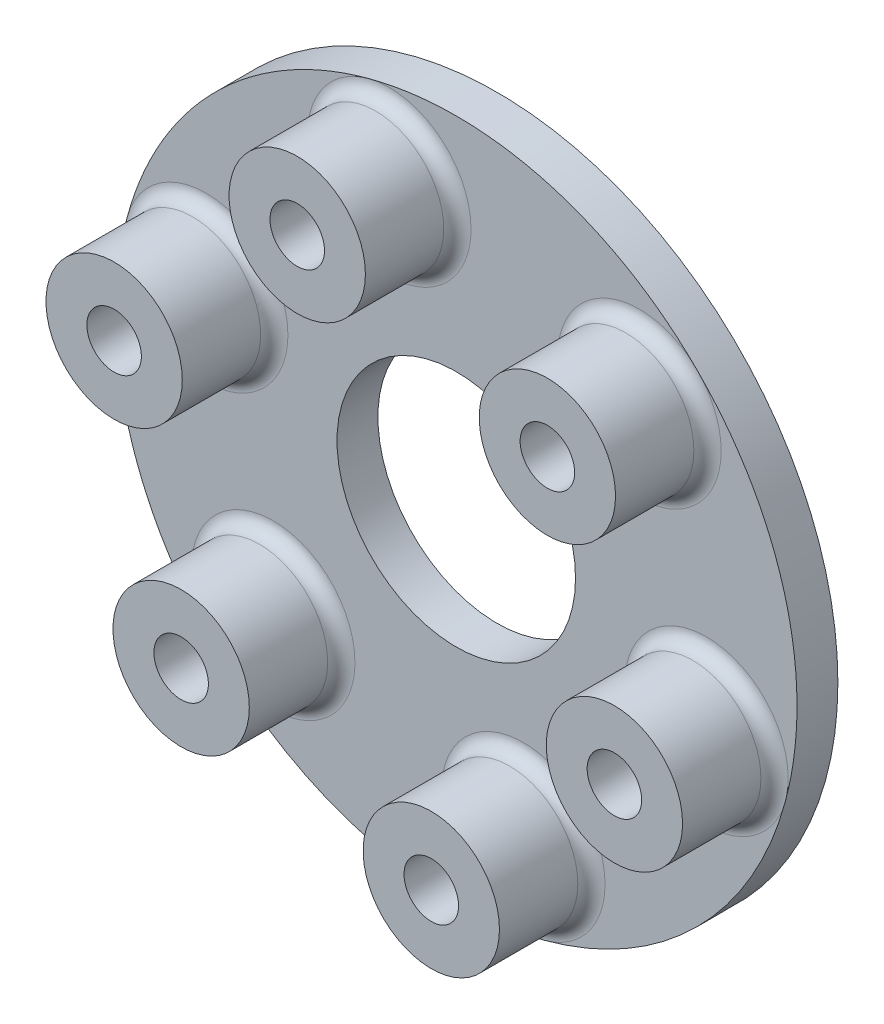
from build123d import *

# Parameters (mm, degrees)
SKETCH1_R           = 25
SKETCH1_R_2         = 8.75
BOSS_EXTRUDE1_DEPTH = 3
SKETCH2_R           = 5
SKETCH2_R_2         = 2
BOSS_EXTRUDE2_DEPTH = 6.75
CUT_EXTRUDE1_START  = -6.75
SKETCH5_R           = 2
CUT_EXTRUDE1_DEPTH  = 6.75
FILLET4_R           = 1
FILLET5_R           = 1
FILLET6_R           = 1
FILLET7_R           = 1
FILLET8_R           = 1
FILLET9_R           = 1


with BuildPart() as part:
    # Sketch1 → Boss-Extrude1 (new body)
    with BuildSketch(Plane.XY):
        Circle(SKETCH1_R)
        Circle(SKETCH1_R_2, mode=Mode.SUBTRACT)
    extrude(amount=BOSS_EXTRUDE1_DEPTH)

    # Sketch2 → Boss-Extrude2 (add)
    # profile 1 of 6: a face of its own
    with BuildSketch(Plane.XY.offset(3)):
        with Locations((-4.917561857, 18.352590699)):
            Circle(SKETCH2_R)
        with Locations((-4.917561857, 18.352590699)):
            Circle(SKETCH2_R_2, mode=Mode.SUBTRACT)
    # profile 2 of 6: a face of its own
    with BuildSketch(Plane.XY.offset(3)):
        with Locations((-18.352590699, 4.917561857)):
            Circle(SKETCH2_R)
        with Locations((-18.352590699, 4.917561857)):
            Circle(SKETCH2_R_2, mode=Mode.SUBTRACT)
    # profile 3 of 6: a face of its own
    with BuildSketch(Plane.XY.offset(3)):
        with Locations((-13.435028843, -13.435028843)):
            Circle(SKETCH2_R)
        with Locations((-13.435028843, -13.435028843)):
            Circle(SKETCH2_R_2, mode=Mode.SUBTRACT)
    # profile 4 of 6: a face of its own
    with BuildSketch(Plane.XY.offset(3)):
        with Locations((4.917561857, -18.352590699)):
            Circle(SKETCH2_R)
        with Locations((4.917561857, -18.352590699)):
            Circle(SKETCH2_R_2, mode=Mode.SUBTRACT)
    # profile 5 of 6: a face of its own
    with BuildSketch(Plane.XY.offset(3)):
        with Locations((18.352590699, -4.917561857)):
            Circle(SKETCH2_R)
        with Locations((18.352590699, -4.917561857)):
            Circle(SKETCH2_R_2, mode=Mode.SUBTRACT)
    # profile 6 of 6: a face of its own
    with BuildSketch(Plane.XY.offset(3)):
        with Locations((13.435028843, 13.435028843)):
            Circle(SKETCH2_R)
        with Locations((13.435028843, 13.435028843)):
            Circle(SKETCH2_R_2, mode=Mode.SUBTRACT)
    extrude(amount=BOSS_EXTRUDE2_DEPTH)

    # Sketch5 → Cut-Extrude1 (cut)
    with BuildSketch(Plane.XY.offset(3).offset(CUT_EXTRUDE1_START)):
        with Locations((-18.352590699, 4.917561857)):
            Circle(SKETCH5_R)
        with Locations((-13.435028843, -13.435028843)):
            Circle(SKETCH5_R)
        with Locations((4.917561857, -18.352590699)):
            Circle(SKETCH5_R)
        with Locations((18.352590699, -4.917561857)):
            Circle(SKETCH5_R)
        with Locations((13.435028843, 13.435028843)):
            Circle(SKETCH5_R)
        with Locations((-4.917561857, 18.352590699)):
            Circle(SKETCH5_R)
    extrude(amount=CUT_EXTRUDE1_DEPTH, mode=Mode.SUBTRACT)

    # Fillet4
    fillet4_edges = [part.edges().sort_by_distance(p)[0] for p in [
        (-18.435028843, -13.435028843, 3),
    ]]
    fillet(fillet4_edges, radius=FILLET4_R - 0.0001)  # a hair under: the kernel refuses the full size

    # Fillet5
    fillet5_edges = [part.edges().sort_by_distance(p)[0] for p in [
        (-23.352590699, 4.917561857, 3),
    ]]
    fillet(fillet5_edges, radius=FILLET5_R - 0.0001)  # a hair under: the kernel refuses the full size

    # Fillet6
    fillet6_edges = [part.edges().sort_by_distance(p)[0] for p in [
        (-9.917561857, 18.352590699, 3),
    ]]
    fillet(fillet6_edges, radius=FILLET6_R - 0.0001)  # a hair under: the kernel refuses the full size

    # Fillet7
    fillet7_edges = [part.edges().sort_by_distance(p)[0] for p in [
        (8.435028843, 13.435028843, 3),
    ]]
    fillet(fillet7_edges, radius=FILLET7_R - 0.0001)  # a hair under: the kernel refuses the full size

    # Fillet8
    fillet8_edges = [part.edges().sort_by_distance(p)[0] for p in [
        (13.352590699, -4.917561857, 3),
    ]]
    fillet(fillet8_edges, radius=FILLET8_R - 0.0001)  # a hair under: the kernel refuses the full size

    # Fillet9
    fillet9_edges = [part.edges().sort_by_distance(p)[0] for p in [
        (-0.082438143, -18.352590699, 3),
    ]]
    fillet(fillet9_edges, radius=FILLET9_R - 0.0001)  # a hair under: the kernel refuses the full size


solid = part.part
